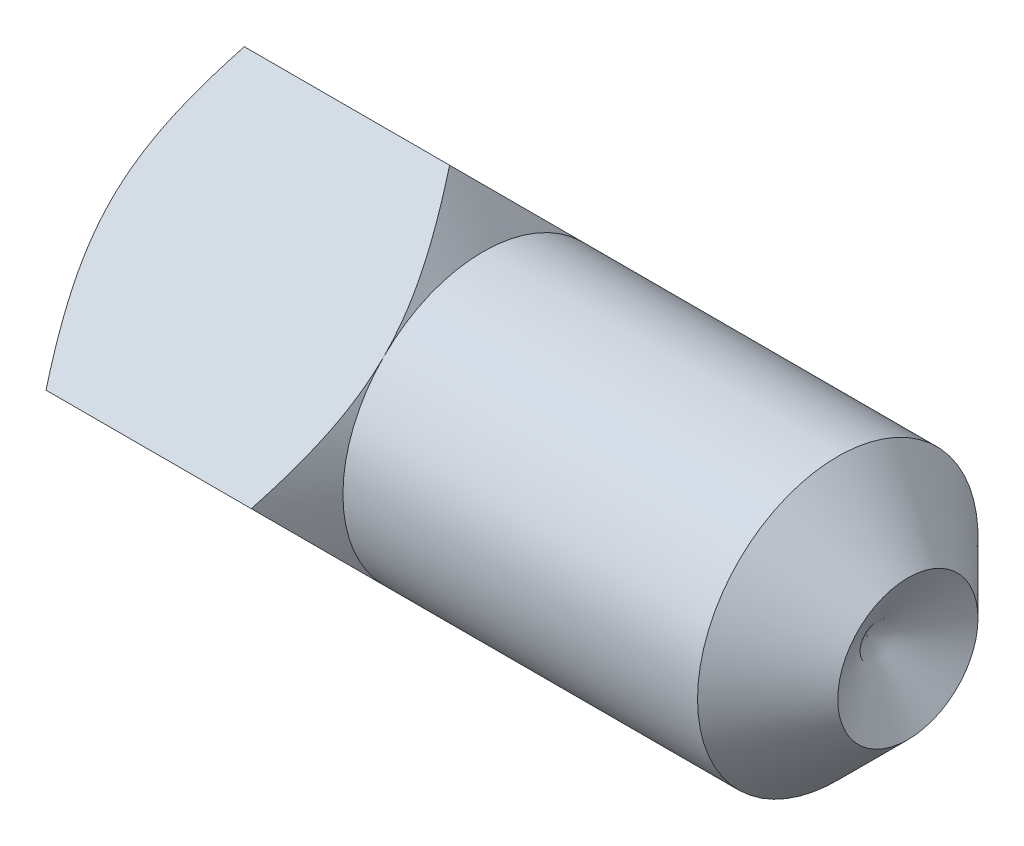
from build123d import *

# Parameters (mm, degrees)
BASEHEAD_DEPTH = 4
BODYSKE_W      = 6.53602765
BODYSKE_H      = 2


with BuildPart() as part:
    # BaseHeadSke → BaseHead (new body)
    with BuildSketch(Plane(origin=(0, 0, 0), x_dir=(0, 0, -1), z_dir=(1, 0, 0))):
        Polygon((0, 2.828427125), (2.828427125, 0), (0, -2.828427125), (-2.828427125, 0), align=None)
    extrude(amount=BASEHEAD_DEPTH)

    # HeadChamferSke → HeadChamfer (revolve, cut)
    with BuildSketch(Plane.XY):
        Polygon((0, 2.828427125), (0, 1.9), (0.53602765, 2.828427125), align=None)
        Polygon((3.46397235, 2.828427125), (4, 1.9), (4, 2.828427125), align=None)
    revolve(axis=Axis((0, 0, 0), (1, 0, 0)), mode=Mode.SUBTRACT)

    # BodySke → BaseBody (revolve)
    with BuildSketch(Plane.XY):
        with Locations((6.731986175, 1)):
            Rectangle(BODYSKE_W, BODYSKE_H)
    revolve(axis=Axis((0, 0, 0), (1, 0, 0)))

    # ChamferEndSke → ChamferEnd (revolve, cut)
    with BuildSketch(Plane.XY):
        Polygon((10, 2), (10, 1), (9, 2), align=None)
    revolve(axis=Axis((0, 0, 0), (1, 0, 0)), mode=Mode.SUBTRACT)

    # CupPointSke → CupPoint (revolve, cut)
    with BuildSketch(Plane.XY):
        Polygon((10, 1), (9.422649731, 0), (10, 0), align=None)
    revolve(axis=Axis((0, 0, 0), (1, 0, 0)), mode=Mode.SUBTRACT)


solid = part.part
